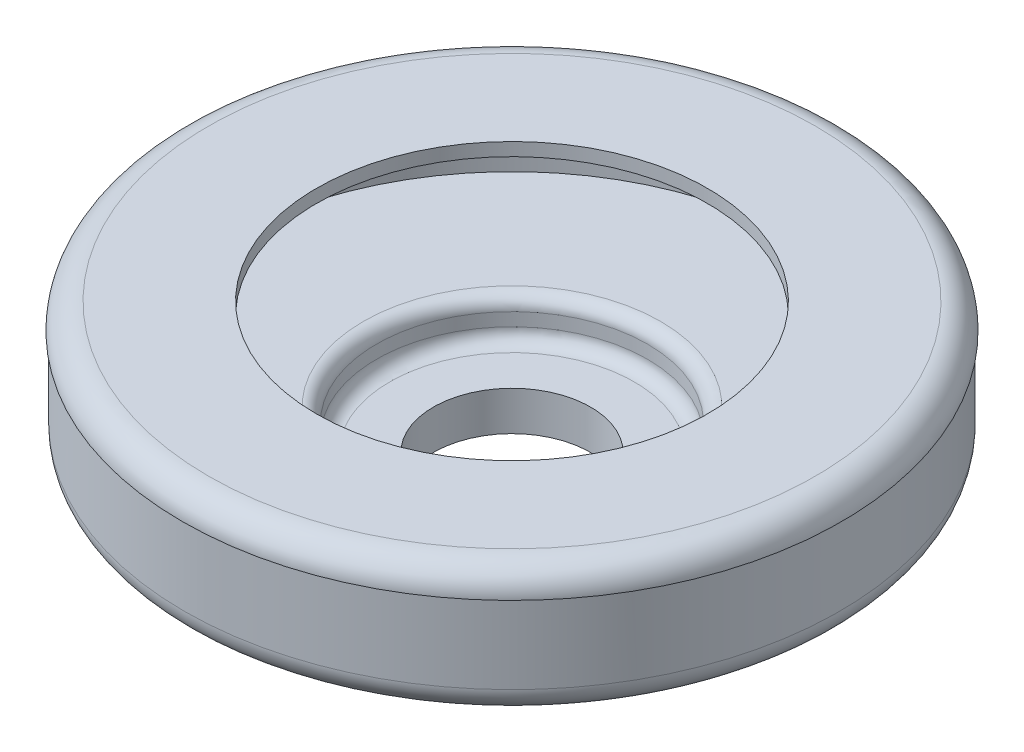
from build123d import *

# Parameters (mm, degrees)
SKETCH_2_W          = 100
SKETCH_2_H          = 85
SKETCH_2_R          = 6
EXTRUDE_1_DEPTH     = 2
SKETCH_3_R          = 25
EXTRUDE_2_DEPTH     = 10
SHELL_START         = -5
SHELL_1_OUTLINE_R   = 22
SHELL_1_DEPTH       = 7
SKETCH_5_R          = 13.33227761
EXTRUDE_3_DEPTH     = 6
SHELL_START_2       = -8
SHELL_2_OUTLINE_R   = 10.33227761
SHELL_2_DEPTH       = 3
FILLET_2_R          = 1
SKETCH_4_R          = 6
CUT_EXTRUDE_2_DEPTH = 19.9
FILLET_3_R          = 1
FILLET_4_R          = 0.25
SKETCH_6_W          = 123.403818804
SKETCH_6_H          = 106.493808558
SKETCH_6_R          = 25.147855886
CUT_EXTRUDE_3_DEPTH = 3
EXTRUDE_START       = -1
SKETCH_7_R          = 22
SKETCH_7_R_2        = 14.917136703
EXTRUDE_4_DEPTH     = 1
FILLET_5_R          = 2


# Read off the part's stored shape, not the designer's step: Оболочка1, Оболочка2
with BuildPart() as part:
    # Эскиз2 → Бобышка-Вытянуть1 (new body)
    with BuildSketch(Plane(origin=(0, 0, 0), x_dir=(1, 0, 0), z_dir=(0, 1, 0))):
        Rectangle(SKETCH_2_W, SKETCH_2_H)
        with Locations(Location((0, 0, 0), (0, 0, 270))):
            Circle(SKETCH_2_R, mode=Mode.SUBTRACT)
        with BuildLine():
            Line((35.797740165, 32.912374401), (38.380753328, 34.849634274))
            ThreePointArc((38.380753328, 34.849634274), (45.172510919, 33.879383189), (44.202259835, 27.087625599))
            Line((44.202259835, 27.087625599), (41.619246672, 25.150365726))
            ThreePointArc((41.619246672, 25.150365726), (34.827489081, 26.120616811), (35.797740165, 32.912374401))
        make_face(mode=Mode.SUBTRACT)
        with BuildLine():
            Line((-38.5, 34.5), (-36.1, 32.7))
            ThreePointArc((-36.1, 32.7), (-35.2, 26.4), (-41.5, 25.5))
            Line((-41.5, 25.5), (-43.9, 27.3))
            ThreePointArc((-43.9, 27.3), (-44.8, 33.6), (-38.5, 34.5))
        make_face(mode=Mode.SUBTRACT)
        with BuildLine():
            Line((38.5, -34.5), (36.1, -32.7))
            ThreePointArc((36.1, -32.7), (35.2, -26.4), (41.5, -25.5))
            Line((41.5, -25.5), (43.9, -27.3))
            ThreePointArc((43.9, -27.3), (44.8, -33.6), (38.5, -34.5))
        make_face(mode=Mode.SUBTRACT)
        with BuildLine():
            Line((-43.9, -27.3), (-41.5, -25.5))
            ThreePointArc((-41.5, -25.5), (-35.2, -26.4), (-36.1, -32.7))
            Line((-36.1, -32.7), (-38.5, -34.5))
            ThreePointArc((-38.5, -34.5), (-44.8, -33.6), (-43.9, -27.3))
        make_face(mode=Mode.SUBTRACT)
    extrude(amount=EXTRUDE_1_DEPTH)

    # Эскиз3 → Бобышка-Вытянуть2 (add)
    with BuildSketch(Plane(origin=(0, 2, 0), x_dir=(1, 0, 0), z_dir=(0, 1, 0))):
        with Locations(Location((0, 0, 0), (0, 0, 270))):
            Circle(SKETCH_3_R)
    extrude(amount=-EXTRUDE_2_DEPTH)

    # Оболочка1 outline → Оболочка1 (cut)
    with BuildSketch(Plane(origin=(0, 0, 0), x_dir=(1, 0, 0), z_dir=(0, 1, 0)).offset(SHELL_START)):
        Circle(SHELL_1_OUTLINE_R)
    extrude(amount=SHELL_1_DEPTH, mode=Mode.SUBTRACT)

    # Эскиз5 → Бобышка-Вытянуть3 (add)
    with BuildSketch(Plane(origin=(0, -5, 0), x_dir=(1, 0, 0), z_dir=(0, 1, 0))):
        with Locations(Location((0, 0, 0), (0, 0, 270))):
            Circle(SKETCH_5_R)
    extrude(amount=-EXTRUDE_3_DEPTH)

    # Оболочка2 outline → Оболочка2 (cut)
    with BuildSketch(Plane(origin=(0, 0, 0), x_dir=(1, 0, 0), z_dir=(0, 1, 0)).offset(SHELL_START_2)):
        Circle(SHELL_2_OUTLINE_R)
    extrude(amount=SHELL_2_DEPTH, mode=Mode.SUBTRACT)

    # Скругление2
    fillet_2_edges = [part.edges().sort_by_distance(p)[0] for p in [
        (0, -11, -13.33227761),
        (0, -8, -13.33227761),
        (-10.33227761, -5, 0),
        (-10.33227761, -8, 0),
    ]]
    fillet(fillet_2_edges, radius=FILLET_2_R)

    # Эскиз4 → Вырез-Вытянуть2 (cut, symmetric)
    with BuildSketch(Plane(origin=(0, -5, 0), x_dir=(1, 0, 0), z_dir=(0, 1, 0))):
        with Locations(Location((0, 0, 0), (0, 0, 270))):
            Circle(SKETCH_4_R)
    extrude(amount=CUT_EXTRUDE_2_DEPTH, both=True, mode=Mode.SUBTRACT)

    # Скругление3
    fillet_3_edges = [part.edges().sort_by_distance(p)[0] for p in [
        (50, 1, 42.5),
        (-50, 1, 42.5),
        (-50, 1, -42.5),
        (50, 1, -42.5),
    ]]
    fillet(fillet_3_edges, radius=FILLET_3_R)

    # Скругление4
    fillet_4_edges = [part.edges().sort_by_distance(p)[0] for p in [
        (50, 0, 0),
        (50, 2, 0),
        (0, 0, 42.5),
        (-50, 0, 0),
        (0, 0, -42.5),
        (-49.707106781, 0, 42.207106781),
        (-49.707106781, 0, -42.207106781),
        (49.707106781, 0, -42.207106781),
        (49.707106781, 0, 42.207106781),
        (0, 2, 42.5),
        (0, 2, -42.5),
        (-50, 2, 0),
        (-49.707106781, 2, 42.207106781),
        (-49.707106781, 2, -42.207106781),
        (49.707106781, 2, -42.207106781),
        (49.707106781, 2, 42.207106781),
    ]]
    fillet(fillet_4_edges, radius=FILLET_4_R)

    # Эскиз6 → Вырез-Вытянуть3 (cut)
    with BuildSketch(Plane(origin=(0, 2, 0), x_dir=(1, 0, 0), z_dir=(0, 1, 0))):
        Rectangle(SKETCH_6_W, SKETCH_6_H)
        with Locations(Location((0, 0, 0), (0, 0, 270))):
            Circle(SKETCH_6_R, mode=Mode.SUBTRACT)
    extrude(amount=-CUT_EXTRUDE_3_DEPTH, mode=Mode.SUBTRACT)

    # Эскиз7 → Бобышка-Вытянуть4 (add)
    with BuildSketch(Plane(origin=(0, 2, 0), x_dir=(1, 0, 0), z_dir=(0, 1, 0)).offset(EXTRUDE_START)):
        with Locations(Location((0, 0, 0), (0, 0, 270))):
            Circle(SKETCH_7_R)
        with Locations(Location((0, 0, 0), (0, 0, 270))):
            Circle(SKETCH_7_R_2, mode=Mode.SUBTRACT)
    extrude(amount=EXTRUDE_4_DEPTH)

    # Скругление5
    fillet_5_edges = [part.edges().sort_by_distance(p)[0] for p in [
        (0, 2, -25.147855886),
        (0, -8, -25),
    ]]
    fillet(fillet_5_edges, radius=FILLET_5_R - 0.0001)  # a hair under: the kernel refuses the full size


solid = part.part
